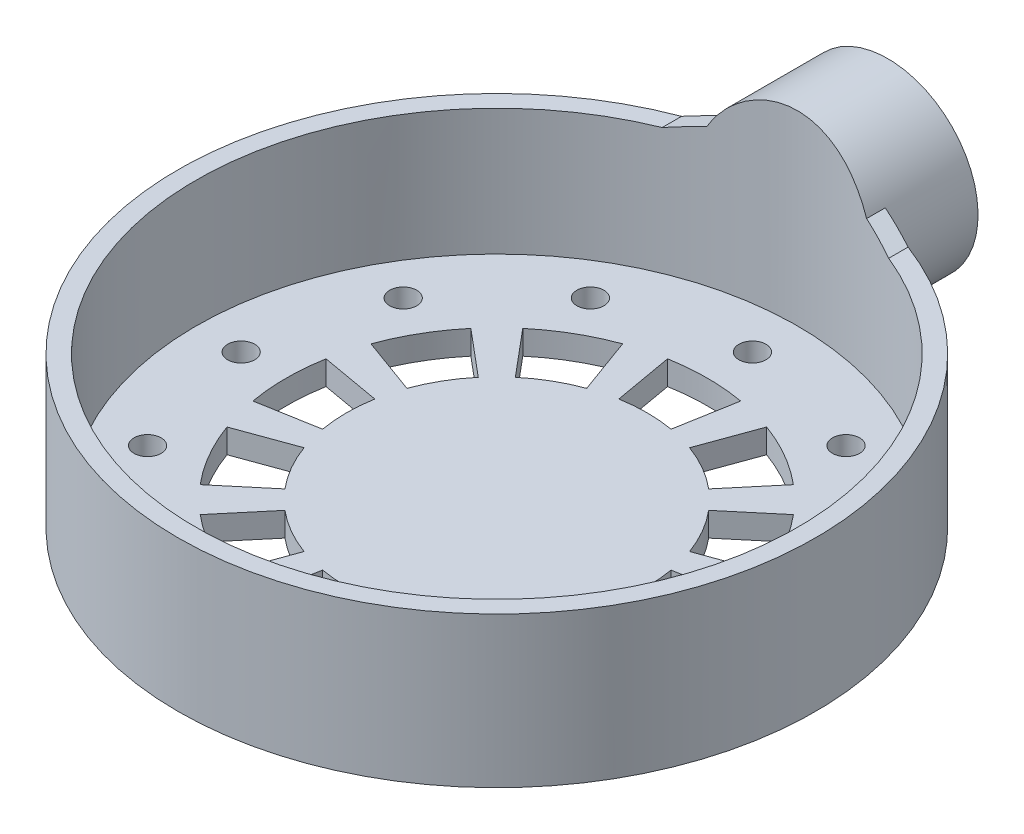
from build123d import *

# Parameters (mm, degrees)
SKETCH_1_R                  = 50
EXTRUDE_1_DEPTH             = 4
HOLE_WIZARD_M41_D           = 4.5
HOLE_WIZARD_M41_CSINK_D     = 5
HOLE_WIZARD_M41_CSINK_ANGLE = 90
CUT_EXTRUDE_1_DEPTH         = 71.823724839
SKETCH_5_R                  = 53
SKETCH_5_R_2                = 50
EXTRUDE_2_DEPTH             = 25
EXTRUDE_3_REACH             = 123.12
EXTRUDE_3_END_RADIUS        = 50
SKETCH_6_R                  = 15
EXTRUDE_3_DIRECTION_2_DEPTH = 12


with BuildPart() as part:
    # Эскиз1 → Бобышка-Вытянуть1 (new body)
    with BuildSketch(Plane(origin=(0, 0, 0), x_dir=(1, 0, 0), z_dir=(0, 1, 0))):
        with Locations(Location((0, 0, 0), (0, 0, 270))):
            Circle(SKETCH_1_R)
    extrude(amount=EXTRUDE_1_DEPTH)

    # Отверстие с зазором M41 (through all)
    with Locations(Plane(origin=(0, 0, 0), x_dir=(-1, 0, 0), z_dir=(0, -1, 0))):
        with Locations((-21.25, 36.806079661), (0, 42.5), (21.25, 36.806079661), (36.806079661, 21.25), (42.5, 0), (36.806079661, -21.25), (21.25, -36.806079661), (0, -42.5), (-21.25, -36.806079661), (-36.806079661, -21.25), (-42.5, 0), (-36.806079661, 21.25)):
            CounterSinkHole(HOLE_WIZARD_M41_D / 2, HOLE_WIZARD_M41_CSINK_D / 2, counter_sink_angle=HOLE_WIZARD_M41_CSINK_ANGLE)

    # Эскиз4 → Вырез-Вытянуть1 (cut, through all)
    with BuildSketch(Plane.XZ):
        with BuildLine():
            Line((11.970705016, 32.889241728), (8.550503583, 23.49231552))
            ThreePointArc((8.550503583, 23.49231552), (12.5, 21.650635095), (16.069690242, 19.151111078))
            Line((16.069690242, 19.151111078), (22.497566339, 26.811555509))
            ThreePointArc((22.497566339, 26.811555509), (17.5, 30.310889132), (11.970705016, 32.889241728))
        make_face()
        with BuildLine():
            Line((-6.077686218, 34.468271355), (-4.341204442, 24.620193825))
            ThreePointArc((-4.341204442, 24.620193825), (0, 25), (4.341204442, 24.620193825))
            Line((4.341204442, 24.620193825), (6.077686218, 34.468271355))
            ThreePointArc((6.077686218, 34.468271355), (0, 35), (-6.077686218, 34.468271355))
        make_face()
        with BuildLine():
            Line((32.889241728, -11.970705016), (23.49231552, -8.550503583))
            ThreePointArc((23.49231552, -8.550503583), (21.650635095, -12.5), (19.151111078, -16.069690242))
            Line((19.151111078, -16.069690242), (26.811555509, -22.497566339))
            ThreePointArc((26.811555509, -22.497566339), (30.310889132, -17.5), (32.889241728, -11.970705016))
        make_face()
        with BuildLine():
            Line((34.468271355, 6.077686218), (24.620193825, 4.341204442))
            ThreePointArc((24.620193825, 4.341204442), (25, 0), (24.620193825, -4.341204442))
            Line((24.620193825, -4.341204442), (34.468271355, -6.077686218))
            ThreePointArc((34.468271355, -6.077686218), (35, 0), (34.468271355, 6.077686218))
        make_face()
        with BuildLine():
            Line((26.811555509, 22.497566339), (19.151111078, 16.069690242))
            ThreePointArc((19.151111078, 16.069690242), (21.650635095, 12.5), (23.49231552, 8.550503583))
            Line((23.49231552, 8.550503583), (32.889241728, 11.970705016))
            ThreePointArc((32.889241728, 11.970705016), (30.310889132, 17.5), (26.811555509, 22.497566339))
        make_face()
        with BuildLine():
            Line((-11.970705016, -32.889241728), (-8.550503583, -23.49231552))
            ThreePointArc((-8.550503583, -23.49231552), (-12.5, -21.650635095), (-16.069690242, -19.151111078))
            Line((-16.069690242, -19.151111078), (-22.497566339, -26.811555509))
            ThreePointArc((-22.497566339, -26.811555509), (-17.5, -30.310889132), (-11.970705016, -32.889241728))
        make_face()
        with BuildLine():
            Line((6.077686218, -34.468271355), (4.341204442, -24.620193825))
            ThreePointArc((4.341204442, -24.620193825), (0, -25), (-4.341204442, -24.620193825))
            Line((-4.341204442, -24.620193825), (-6.077686218, -34.468271355))
            ThreePointArc((-6.077686218, -34.468271355), (0, -35), (6.077686218, -34.468271355))
        make_face()
        with BuildLine():
            Line((22.497566339, -26.811555509), (16.069690242, -19.151111078))
            ThreePointArc((16.069690242, -19.151111078), (12.5, -21.650635095), (8.550503583, -23.49231552))
            Line((8.550503583, -23.49231552), (11.970705016, -32.889241728))
            ThreePointArc((11.970705016, -32.889241728), (17.5, -30.310889132), (22.497566339, -26.811555509))
        make_face()
        with BuildLine():
            Line((-22.497566339, 26.811555509), (-16.069690242, 19.151111078))
            ThreePointArc((-16.069690242, 19.151111078), (-12.5, 21.650635095), (-8.550503583, 23.49231552))
            Line((-8.550503583, 23.49231552), (-11.970705016, 32.889241728))
            ThreePointArc((-11.970705016, 32.889241728), (-17.5, 30.310889132), (-22.497566339, 26.811555509))
        make_face()
        with BuildLine():
            Line((-32.889241728, 11.970705016), (-23.49231552, 8.550503583))
            ThreePointArc((-23.49231552, 8.550503583), (-21.650635095, 12.5), (-19.151111078, 16.069690242))
            Line((-19.151111078, 16.069690242), (-26.811555509, 22.497566339))
            ThreePointArc((-26.811555509, 22.497566339), (-30.310889132, 17.5), (-32.889241728, 11.970705016))
        make_face()
        with BuildLine():
            Line((-34.468271355, -6.077686218), (-24.620193825, -4.341204442))
            ThreePointArc((-24.620193825, -4.341204442), (-25, 0), (-24.620193825, 4.341204442))
            Line((-24.620193825, 4.341204442), (-34.468271355, 6.077686218))
            ThreePointArc((-34.468271355, 6.077686218), (-35, 0), (-34.468271355, -6.077686218))
        make_face()
        with BuildLine():
            Line((-26.811555509, -22.497566339), (-19.151111078, -16.069690242))
            ThreePointArc((-19.151111078, -16.069690242), (-21.650635095, -12.5), (-23.49231552, -8.550503583))
            Line((-23.49231552, -8.550503583), (-32.889241728, -11.970705016))
            ThreePointArc((-32.889241728, -11.970705016), (-30.310889132, -17.5), (-26.811555509, -22.497566339))
        make_face()
    extrude(amount=-CUT_EXTRUDE_1_DEPTH, mode=Mode.SUBTRACT)

    # Эскиз5 → Бобышка-Вытянуть2 (add)
    with BuildSketch(Plane.XZ):
        with Locations(Location((0, 0, 0), (0, 0, 270))):
            Circle(SKETCH_5_R)
        with Locations(Location((0, 0, 0), (0, 0, 270))):
            Circle(SKETCH_5_R_2, mode=Mode.SUBTRACT)
    extrude(amount=-EXTRUDE_2_DEPTH)

    # Бобышка-Вытянуть3: up to this cylinder (the profile starts outside it)
    extrude_3_end = Plane(origin=(0, 20, 0), z_dir=(0, -1, 0)) * Cylinder(EXTRUDE_3_END_RADIUS, 347.24, mode=Mode.PRIVATE)
    # Эскиз6 → Бобышка-Вытянуть3 (add, up to the surface)
    with BuildSketch(Plane(origin=(0, 0, -53), x_dir=(-1, 0, 0), z_dir=(0, 0, -1)), mode=Mode.PRIVATE) as extrude_3_sk1:
        with Locations(Location((0, 20, 0), (0, 0, 270))):
            Circle(SKETCH_6_R)
    extrude_3_tool1 = extrude(extrude_3_sk1.sketch, amount=-EXTRUDE_3_REACH, mode=Mode.PRIVATE) - extrude_3_end
    add(extrude_3_tool1.solids().sort_by_distance((0, 20, -53))[0])

    # Эскиз6 → Бобышка-Вытянуть3 direction 2 (add)
    with BuildSketch(Plane(origin=(0, 0, -53), x_dir=(-1, 0, 0), z_dir=(0, 0, -1))):
        with Locations(Location((0, 20, 0), (0, 0, 270))):
            Circle(SKETCH_6_R)
    extrude(amount=EXTRUDE_3_DIRECTION_2_DEPTH)

    # Фаска1
    # the kernel refuses this chamfer: 4.922263446, 3 mm, written as the material it adds along each edge
    with BuildSketch(Plane(origin=(-14.142135624, 25, -35.782012711), x_dir=(0.4567037987045211, 0.8896188173868965, 0), z_dir=(0, 0, -1))) as chamfer_1_piece_1_section:
        with BuildLine():
            Line((2.315673344, 0), (-2.283325225, -4.302139097))
            Line((-2.283325225, -4.302139097), (-2.370903989, -4.257178768))
            ThreePointArc((-2.370903989, -4.257178768), (-1.199667859, -2.121291383), (-0.087578764, 0.044960328))
            Line((-0.087578764, 0.044960328), (0.013196083, 0.097556826))
            ThreePointArc((0.013196083, 0.097556826), (1.157121783, -0.012460261), (2.31461529, 0.098439583))
            Line((2.31461529, 0.098439583), (2.315673344, 0))
        make_face()
    chamfer_1_piece_1 = extrude(amount=27.472660966, mode=Mode.PRIVATE)
    chamfer_1_piece_1 = chamfer_1_piece_1 & Plane(origin=(0, 25.614085428, 0), x_dir=(0, 0, -1), z_dir=(0, -1, 0)) * Cylinder(53, 73, mode=Mode.PRIVATE)
    chamfer_1_piece_1 = chamfer_1_piece_1 - Plane(origin=(0, 25.614085428, 0), x_dir=(0, 0, -1), z_dir=(0, -1, 0)) * Cylinder(50, 73, mode=Mode.PRIVATE)
    add(chamfer_1_piece_1)
    with BuildSketch(Plane(origin=(14.142135624, 25, -35.782012711), x_dir=(-0.45670379870452116, 0.8896188173868965, 0), z_dir=(0, 0, -1))) as chamfer_1_piece_2_section:
        with BuildLine():
            Line((2.315673344, 0), (-2.283325225, 4.302139097))
            Line((-2.283325225, 4.302139097), (-2.370903989, 4.257178768))
            ThreePointArc((-2.370903989, 4.257178768), (-1.199667859, 2.121291383), (-0.087578764, -0.044960328))
            Line((-0.087578764, -0.044960328), (0.013196083, -0.097556826))
            ThreePointArc((0.013196083, -0.097556826), (1.157121783, 0.012460261), (2.31461529, -0.098439583))
            Line((2.31461529, -0.098439583), (2.315673344, 0))
        make_face()
    chamfer_1_piece_2 = extrude(amount=27.472660966, mode=Mode.PRIVATE)
    chamfer_1_piece_2 = chamfer_1_piece_2 & Plane(origin=(0, 25.614085428, 0), x_dir=(0, 0, -1), z_dir=(0, -1, 0)) * Cylinder(53, 73, mode=Mode.PRIVATE)
    chamfer_1_piece_2 = chamfer_1_piece_2 - Plane(origin=(0, 25.614085428, 0), x_dir=(0, 0, -1), z_dir=(0, -1, 0)) * Cylinder(50, 73, mode=Mode.PRIVATE)
    add(chamfer_1_piece_2)


solid = part.part
